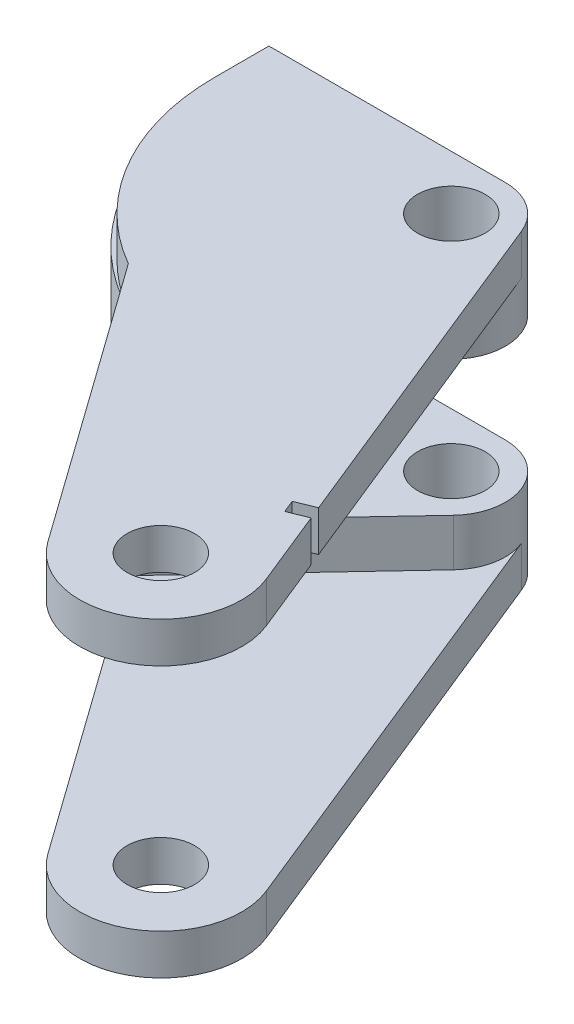
from build123d import *
from build123d.topology import SkipClean

# Parameters (mm, degrees)
SKETCH2_R           = 5
BOSS_EXTRUDE1_DEPTH = 6
BOSS_EXTRUDE2_START = 7
SKETCH3_R           = 5
BOSS_EXTRUDE2_DEPTH = 7
BOSS_EXTRUDE3_START = 5
SKETCH4_W           = 22.995704609
SKETCH4_H           = 8
BOSS_EXTRUDE3_DEPTH = 5
BOSS_EXTRUDE4_START = 5
SKETCH5_W           = 18
SKETCH5_H           = 8
BOSS_EXTRUDE4_DEPTH = 5
MIRROR1_START       = -40
MIRROR1_OUTLINE_R   = 5
MIRROR1_DEPTH       = 6
MIRROR1_START_2     = -34
MIRROR1_2_DEPTH     = 17
MIRROR1_3_OUTLINE_R = 5
MIRROR1_3_DEPTH     = 7
MIRROR1_START_3     = -27
MIRROR1_4_DEPTH     = 5
CUT_EXTRUDE1_DEPTH  = 14


# Read off the part's stored shape, not the designer's step: Mirror1
with BuildPart() as part:
    # Sketch2 → Boss-Extrude1 (new body)
    with BuildSketch(Plane(origin=(0, 0, 0), x_dir=(1, 0, 0), z_dir=(0, 1, 0))):
        with BuildLine():
            ThreePointArc((7.415342239, 3.002115835), (4.471189625, 6.633887498), (0, 8))
            Line((0, 8), (-35, 8))
            Line((-35, 8), (-35, 0))
            ThreePointArc((-35, 0), (-30.310889132, -17.5), (-17.5, -30.310889132))
            Line((-17.5, -30.310889132), (12.232451358, -71.97101094))
            ThreePointArc((12.232451358, -71.97101094), (27.776984485, -75.517910927), (33.123013358, -60.496826248))
            Line((33.123013358, -60.496826248), (7.415342239, 3.002115835))
        make_face()
        with Locations(Location((0, 0, 0), (0, 0, 270))):
            Circle(SKETCH2_R, mode=Mode.SUBTRACT)
        with Locations(Location((22, -65, 0), (0, 0, 270))):
            Circle(SKETCH2_R, mode=Mode.SUBTRACT)
    extrude(amount=BOSS_EXTRUDE1_DEPTH)

    # Sketch3 → Boss-Extrude2 (add)
    with SkipClean():  # the faces are left unmerged after this step: merging them gives an invalid solid
        with BuildSketch(Plane.XZ.offset(BOSS_EXTRUDE2_START)):
            with BuildLine():
                Line((5.830508196, 5.47769789), (-17.5, 30.310889132))
                ThreePointArc((-17.5, 30.310889132), (-31.638718646, 17.785480653), (-38, 0))
                Line((-38, 0), (-38, -8))
                Line((-38, -8), (-35, -8))
                Line((-35, -8), (0, -8))
                ThreePointArc((0, -8), (7.342396854, -3.176351435), (5.830508196, 5.47769789))
            make_face()
            with Locations(Location((0, 0, 0), (0, 0, 270))):
                Circle(SKETCH3_R, mode=Mode.SUBTRACT)
        extrude(amount=-BOSS_EXTRUDE2_DEPTH)

    # Sketch4 → Boss-Extrude3 (add)
    with SkipClean():  # the faces are left unmerged after this step: merging them gives an invalid solid
        with BuildSketch(Plane.XZ.offset(7).offset(BOSS_EXTRUDE3_START)):
            with BuildLine():
                Line((-38, 0), (-15.004295391, 0))
                ThreePointArc((-15.004295391, 0), (-12.994100974, 7.502147695), (-7.502147695, 12.994100974))
                Line((-7.502147695, 12.994100974), (-17.5, 30.310889132))
                ThreePointArc((-17.5, 30.310889132), (-31.638718646, 17.785480653), (-38, 0))
            make_face()
            with Locations((-26.502147695, -4)):
                Rectangle(SKETCH4_W, SKETCH4_H)
        extrude(amount=-BOSS_EXTRUDE3_DEPTH)

    # Sketch5 → Boss-Extrude4 (add)
    with SkipClean():  # the faces are left unmerged after this step: merging them gives an invalid solid
        with BuildSketch(Plane.XZ.offset(12).offset(BOSS_EXTRUDE4_START)):
            with Locations((-29, -4)):
                Rectangle(SKETCH5_W, SKETCH5_H)
            with BuildLine():
                ThreePointArc((-20, 0), (-17.320508076, 10), (-10, 17.320508076))
                Line((-10, 17.320508076), (-17.5, 30.310889132))
                ThreePointArc((-17.5, 30.310889132), (-31.638718646, 17.785480653), (-38, 0))
                Line((-38, 0), (-20, 0))
            make_face()
        extrude(amount=-BOSS_EXTRUDE4_DEPTH)



with BuildPart() as body_2:
    # Mirror1 outline → Mirror1 (new body)
    with BuildSketch(Plane(origin=(0, 0, 0), x_dir=(1, 0, 0), z_dir=(0, 1, 0)).offset(MIRROR1_START)):
        with BuildLine():
            Line((0, 8), (-35, 8))
            Line((-35, 8), (-35, 0))
            ThreePointArc((-35, 0), (-30.310889132, -17.5), (-17.5, -30.310889132))
            Line((-17.5, -30.310889132), (12.232451358, -71.97101094))
            ThreePointArc((12.232451358, -71.97101094), (27.776984485, -75.517910927), (33.123013358, -60.496826248))
            Line((33.123013358, -60.496826248), (7.415342239, 3.002115835))
            ThreePointArc((7.415342239, 3.002115835), (4.471189625, 6.633887498), (0, 8))
        make_face()
        Circle(MIRROR1_OUTLINE_R, mode=Mode.SUBTRACT)
        with Locations((22, -65)):
            Circle(MIRROR1_OUTLINE_R, mode=Mode.SUBTRACT)
    extrude(amount=MIRROR1_DEPTH)


with BuildPart() as part_1:
    with SkipClean():  # the faces are left unmerged after this step: merging them gives an invalid solid
        add(part.part)

        add(body_2.part)  # Mirror1 2 merges body 2
        # Mirror1 2 outline → Mirror1 2 (add)
        with BuildSketch(Plane(origin=(0, 0, 0), x_dir=(1, 0, 0), z_dir=(0, 1, 0)).offset(MIRROR1_START_2)):
            with BuildLine():
                ThreePointArc((-38, 0), (-31.638718646, -17.785480653), (-17.5, -30.310889132))
                Line((-17.5, -30.310889132), (-10, -17.320508076))
                ThreePointArc((-10, -17.320508076), (-17.320508076, -10), (-20, 0))
                Line((-20, 0), (-20, 8))
                Line((-20, 8), (-38, 8))
                Line((-38, 8), (-38, 0))
            make_face()
        extrude(amount=MIRROR1_2_DEPTH)

    # Mirror1 3 outline → Mirror1 3 (add)
    with SkipClean():  # the faces are left unmerged after this step: merging them gives an invalid solid
        with BuildSketch(Plane(origin=(0, 0, 0), x_dir=(1, 0, 0), z_dir=(0, 1, 0)).offset(MIRROR1_START_2)):
            with BuildLine():
                Line((-17.5, -30.310889132), (5.830508196, -5.47769789))
                ThreePointArc((5.830508196, -5.47769789), (7.342396854, 3.176351435), (0, 8))
                Line((0, 8), (-20, 8))
                Line((-20, 8), (-20, 0))
                ThreePointArc((-20, 0), (-17.320508076, -10), (-10, -17.320508076))
                Line((-10, -17.320508076), (-17.5, -30.310889132))
            make_face()
            Circle(MIRROR1_3_OUTLINE_R, mode=Mode.SUBTRACT)
        extrude(amount=MIRROR1_3_DEPTH)

    # Mirror1 4 outline → Mirror1 4 (add)
    with SkipClean():  # the faces are left unmerged after this step: merging them gives an invalid solid
        with BuildSketch(Plane(origin=(0, 0, 0), x_dir=(1, 0, 0), z_dir=(0, 1, 0)).offset(MIRROR1_START_3)):
            with BuildLine():
                ThreePointArc((-20, 0), (-17.320508076, -10), (-10, -17.320508076))
                Line((-10, -17.320508076), (-7.502147695, -12.994100974))
                ThreePointArc((-7.502147695, -12.994100974), (-12.994100974, -7.502147695), (-15.004295391, 0))
                Line((-15.004295391, 0), (-15.004295391, 8))
                Line((-15.004295391, 8), (-20, 8))
                Line((-20, 8), (-20, 0))
            make_face()
        extrude(amount=MIRROR1_4_DEPTH)

    # Sketch6 → Cut-Extrude1 (cut)
    with SkipClean():  # the faces are left unmerged after this step: merging them gives an invalid solid
        with BuildSketch(Plane(origin=(0, 6, 0), x_dir=(1, 0, 0), z_dir=(0, 1, 0))):
            Polygon((25.839086267, -50.499606328), (28.619839606, -49.37381289), (27.869310647, -47.519977331), (25.088557308, -48.645770769), align=None)
        extrude(amount=-CUT_EXTRUDE1_DEPTH, mode=Mode.SUBTRACT)


solid = part_1.part
